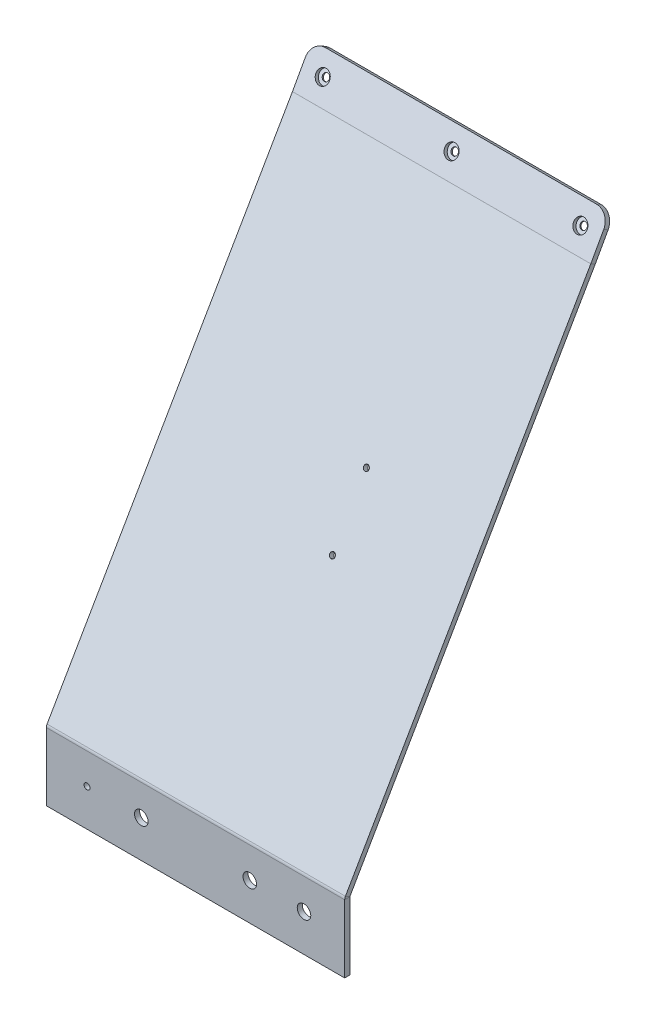
from build123d import *

# Parameters (mm, degrees)
BASE_FLANGE1_DEPTH = 279.4
SKETCH4_R          = 3.175
TAB1_DEPTH         = 4.7752
SKETCH4_2_R        = 3.175
CUT_EXTRUDE1_DEPTH = 7.62
SKETCH5_R          = 6.35
SKETCH5_R_2        = 2.7813
CUT_EXTRUDE2_DEPTH = 10.16
SKETCH6_R          = 6.35
CUT_EXTRUDE3_DEPTH = 3.429
FILLET1_R          = 12.7
FILLET2_R          = 12.7
SKETCH7_R          = 2.5527
CUT_EXTRUDE4_DEPTH = 7.62


# Sheet-metal steps are written as plain solids
with BuildPart() as part:
    # Sketch1 → Base-Flange1 (new body)
    with BuildSketch(Plane(origin=(0, 0, 0), x_dir=(0, 0, -1), z_dir=(1, 0, 0))):
        with BuildLine():
            Line((0, 0), (0, 63.431940905))
            ThreePointArc((0, 63.431940905), (0.00865484, 63.497680943), (0.034029547, 63.558940905))
            Line((0.034029547, 63.558940905), (229.848055418, 461.608510005))
            ThreePointArc((229.848055418, 461.608510005), (229.869833323, 461.646613437), (229.891277889, 461.684905463))
            Line((229.891277889, 461.684905463), (248.119591573, 494.569653848))
            Line((248.119591573, 494.569653848), (243.943107547, 496.884716746))
            Line((243.943107547, 496.884716746), (225.714793821, 463.999968287))
            ThreePointArc((225.714793821, 463.999968287), (225.713710761, 463.998034347), (225.712610867, 463.996109931))
            Line((225.712610867, 463.996109931), (-4.101414961, 65.946540905))
            ThreePointArc((-4.101414961, 65.946540905), (-4.603834166, 64.733593647), (-4.7752, 63.431940905))
            Line((-4.7752, 63.431940905), (-4.7752, 0))
            Line((-4.7752, 0), (0, 0))
        make_face()
    extrude(amount=-BASE_FLANGE1_DEPTH)

    # Sketch4 → Tab1 (add)
    with BuildSketch(Plane(origin=(0, 11.035159758, 19.907955191), x_dir=(-1, 0, 0), z_dir=(0, -0.48480962024634994, -0.8746197071393886))):
        with Locations((19.05, 534.436130775)):
            Circle(SKETCH4_R)
        with Locations((139.7, 534.436130775)):
            Circle(SKETCH4_R)
        with Locations((260.35, 534.436130775)):
            Circle(SKETCH4_R)
    extrude(amount=-TAB1_DEPTH)

    # Sketch4<2> → Cut-Extrude1 (cut)
    with BuildSketch(Plane(origin=(0, 11.035159758, 19.907955191), x_dir=(-1, 0, 0), z_dir=(0, -0.48480962024634994, -0.8746197071393886))):
        with Locations(Location((19.05, 534.436130775, 0), (0, 0, 90))):
            Circle(SKETCH4_2_R)
        with Locations(Location((139.7, 534.436130775, 0), (0, 0, 90))):
            Circle(SKETCH4_2_R)
        with Locations(Location((260.35, 534.436130775, 0), (0, 0, 90))):
            Circle(SKETCH4_2_R)
    extrude(amount=-CUT_EXTRUDE1_DEPTH, mode=Mode.SUBTRACT)

    # Sketch5 → Cut-Extrude2 (cut)
    with BuildSketch(Plane(origin=(0, 0, 0), x_dir=(-1, 0, 0), z_dir=(0, 0, -1))):
        with Locations((38.1, 34.7472)):
            Circle(SKETCH5_R)
        with Locations((88.9, 34.7472)):
            Circle(SKETCH5_R)
        with Locations((190.5, 34.7472)):
            Circle(SKETCH5_R)
        with Locations((241.3, 34.7472)):
            Circle(SKETCH5_R_2)
    extrude(amount=-CUT_EXTRUDE2_DEPTH, mode=Mode.SUBTRACT)

    # Sketch6 → Cut-Extrude3 (cut)
    with BuildSketch(Plane(origin=(0, 13.350222657, 24.084439216), x_dir=(1, 0, 0), z_dir=(0, 0.48480962024634877, 0.8746197071393893))):
        with Locations(Location((-260.35, 534.436130775, 0), (0, 0, 270))):
            Circle(SKETCH6_R)
        with Locations(Location((-139.7, 534.436130775, 0), (0, 0, 270))):
            Circle(SKETCH6_R)
        with Locations(Location((-19.05, 534.436130775, 0), (0, 0, 270))):
            Circle(SKETCH6_R)
    extrude(amount=-CUT_EXTRUDE3_DEPTH, mode=Mode.SUBTRACT)

    # Fillet1
    fillet1_edges = [part.edges().sort_by_distance(p)[0] for p in [
        (-279.4, 495.727185297, -246.03134956),
    ]]
    fillet(fillet1_edges, radius=FILLET1_R)

    # Fillet2
    fillet2_edges = [part.edges().sort_by_distance(p)[0] for p in [
        (0, 495.727185297, -246.03134956),
    ]]
    fillet(fillet2_edges, radius=FILLET2_R)

    # Sketch7 → Cut-Extrude4 (cut)
    with BuildSketch(Plane(origin=(0, 18.2626, 31.631751078), x_dir=(1, 0, 0), z_dir=(0, 0.5000000000000011, 0.8660254037844382))):
        with Locations(Location((-111.125, 316.624698106, 0), (0, 0, 270))):
            Circle(SKETCH7_R)
        with Locations(Location((-111.125, 253.124698106, 0), (0, 0, 270))):
            Circle(SKETCH7_R)
    extrude(amount=-CUT_EXTRUDE4_DEPTH, mode=Mode.SUBTRACT)


solid = part.part
